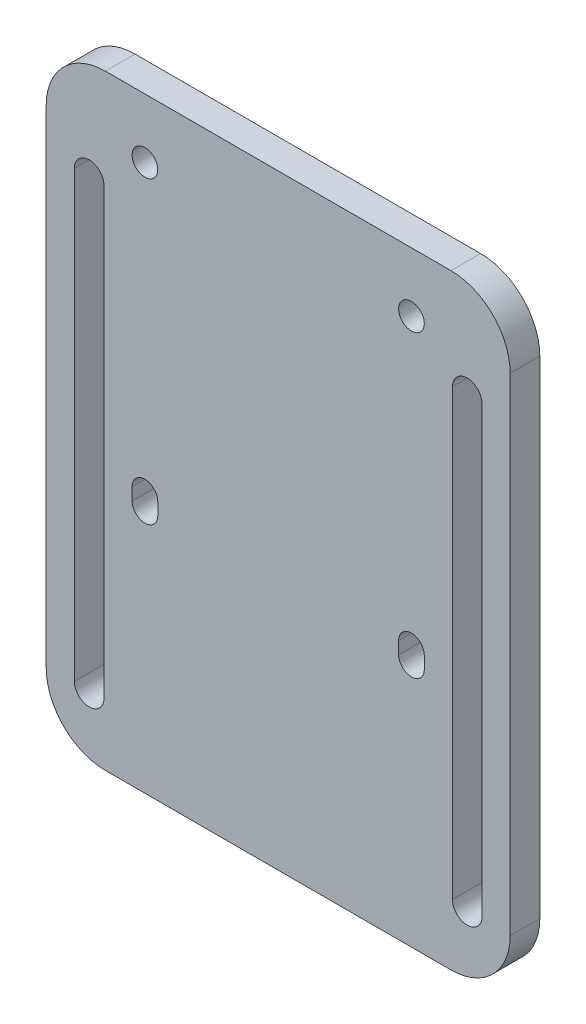
from build123d import *

# Parameters (mm, degrees)
MODEL_R    = 2.6
BASE_DEPTH = 6


with BuildPart() as part:
    # Model → Base (new body)
    with BuildSketch(Plane.XY):
        with BuildLine():
            Line((-35, 0), (35, 0))
            ThreePointArc((35, 0), (43.485281374, 3.514718626), (47, 12))
            Line((47, 12), (47, 110.7))
            ThreePointArc((47, 110.7), (43.485281374, 119.185281374), (35, 122.7))
            Line((35, 122.7), (-35, 122.7))
            ThreePointArc((-35, 122.7), (-43.485281374, 119.185281374), (-47, 110.7))
            Line((-47, 110.7), (-47, 12))
            ThreePointArc((-47, 12), (-43.485281374, 3.514718626), (-35, 0))
        make_face()
        with BuildLine():
            ThreePointArc((-35.3, 12.5), (-38.3, 9.5), (-41.3, 12.5))
            Line((-41.3, 12.5), (-41.3, 102.5))
            ThreePointArc((-41.3, 102.5), (-38.3, 105.5), (-35.3, 102.5))
            Line((-35.3, 102.5), (-35.3, 12.5))
        make_face(mode=Mode.SUBTRACT)
        with BuildLine():
            ThreePointArc((-24.4, 50), (-27, 47.4), (-29.6, 50))
            Line((-29.6, 50), (-29.6, 52.5))
            ThreePointArc((-29.6, 52.5), (-27, 55.1), (-24.4, 52.5))
            Line((-24.4, 52.5), (-24.4, 50))
        make_face(mode=Mode.SUBTRACT)
        with BuildLine():
            ThreePointArc((24.4, 52.5), (27, 55.1), (29.6, 52.5))
            Line((29.6, 52.5), (29.6, 50))
            ThreePointArc((29.6, 50), (27, 47.4), (24.4, 50))
            Line((24.4, 50), (24.4, 52.5))
        make_face(mode=Mode.SUBTRACT)
        with BuildLine():
            ThreePointArc((41.3, 12.5), (38.3, 9.5), (35.3, 12.5))
            Line((35.3, 12.5), (35.3, 102.5))
            ThreePointArc((35.3, 102.5), (38.3, 105.5), (41.3, 102.5))
            Line((41.3, 102.5), (41.3, 12.5))
        make_face(mode=Mode.SUBTRACT)
        with Locations((-27, 110.7)):
            Circle(MODEL_R, mode=Mode.SUBTRACT)
        with Locations((27, 110.7)):
            Circle(MODEL_R, mode=Mode.SUBTRACT)
    extrude(amount=BASE_DEPTH)


solid = part.part
